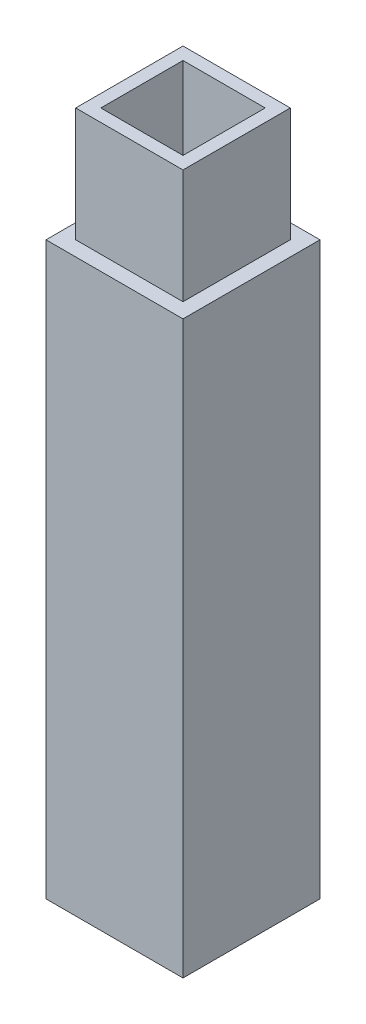
from build123d import *

# Parameters (mm, degrees)
SKETCH1_W           = 30
SKETCH1_H           = 30
BOSS_EXTRUDE1_DEPTH = 150
SKETCH2_W           = 25
SKETCH2_H           = 25
CUT_EXTRUDE1_DEPTH  = 27
SKETCH3_W           = 18
SKETCH3_H           = 18
CUT_EXTRUDE2_DEPTH  = 180
SKETCH4_OUTSIDE_W   = 63.176
SKETCH4_OUTSIDE_H   = 63.176
SKETCH4_OUTSIDE_W_2 = 23.5
SKETCH4_OUTSIDE_H_2 = 23.5
CUT_EXTRUDE3_DEPTH  = 25
WRAP1_DEPTH         = 2
SCALE1_SCALE        = 0.6


# Read off the part's stored shape, not the designer's step: Wrap1
with BuildPart() as part:
    # Sketch1 → Boss-Extrude1 (new body)
    with BuildSketch(Plane(origin=(0, 0, 0), x_dir=(1, 0, 0), z_dir=(0, 1, 0))):
        Rectangle(SKETCH1_W, SKETCH1_H)
    extrude(amount=BOSS_EXTRUDE1_DEPTH)

    # Sketch2 → Cut-Extrude1 (cut)
    with BuildSketch(Plane.XZ):
        Rectangle(SKETCH2_W, SKETCH2_H)
    extrude(amount=-CUT_EXTRUDE1_DEPTH, mode=Mode.SUBTRACT)

    # Sketch3 → Cut-Extrude2 (cut)
    with BuildSketch(Plane.XZ.offset(-27)):
        Rectangle(SKETCH3_W, SKETCH3_H)
    extrude(amount=-CUT_EXTRUDE2_DEPTH, mode=Mode.SUBTRACT)

    # Sketch4 outside → Cut-Extrude3 (cut)
    with BuildSketch(Plane(origin=(0, 150, 0), x_dir=(1, 0, 0), z_dir=(0, 1, 0))):
        Rectangle(SKETCH4_OUTSIDE_W, SKETCH4_OUTSIDE_H)
        Rectangle(SKETCH4_OUTSIDE_W_2, SKETCH4_OUTSIDE_H_2, mode=Mode.SUBTRACT)
    extrude(amount=-CUT_EXTRUDE3_DEPTH, mode=Mode.SUBTRACT)

    # Wrap1 outline → Wrap1 (add)
    # profile 1 of 3: a face of its own
    with BuildSketch(Plane(origin=(0, 0, -15), x_dir=(-1, 0, 0), z_dir=(0, 0, -1))):
        with BuildLine():
            add(Edge.make_bspline(
                [(-3.922817468, 45.671153846), (-4.093770018, 45.695144318), (-4.427682658, 45.742003647), (-4.912261402, 45.857196758), (-5.373060043, 45.990410607), (-5.807605616, 46.160772279), (-6.215429676, 46.357424097), (-6.596897172, 46.586746804), (-6.957482483, 46.838099681), (-7.173570101, 47.034893269), (-7.280990544, 47.132722356)],
                knots=[0, 0, 0, 0, 0.138943325, 0.2713907, 0.400711228, 0.524932707, 0.646800357, 0.764858493, 0.883107579, 1, 1, 1, 1], degree=3))
            Line((-3.922817468, 45.671153846), (-3.922817468, 49.090384615))
            add(Edge.make_bspline(
                [(-5.632432852, 51.318990385), (-5.626334799, 51.19510168), (-5.614234393, 50.949268545), (-5.523920172, 50.589786921), (-5.37188742, 50.248399145), (-5.162243215, 49.932174394), (-4.910469412, 49.645677437), (-4.612295603, 49.410546093), (-4.285585897, 49.21497499), (-4.044214327, 49.13207755), (-3.922817468, 49.090384615)],
                knots=[0, 0, 0, 0, 0.123522589, 0.245106649, 0.36726561, 0.494690546, 0.622323873, 0.746002836, 0.872253148, 1, 1, 1, 1], degree=3))
            add(Edge.make_bspline(
                [(-3.838863141, 53.242307692), (-3.96291507, 53.235739113), (-4.205038173, 53.222918636), (-4.552185339, 53.121395028), (-4.863278063, 52.949105261), (-5.134836655, 52.715335514), (-5.356350553, 52.428146835), (-5.521099871, 52.095778244), (-5.617208556, 51.719913909), (-5.627243154, 51.455658242), (-5.632432852, 51.318990385)],
                knots=[0, 0, 0, 0, 0.126165598, 0.246248538, 0.364494603, 0.485724426, 0.608514578, 0.73130473, 0.861036067, 1, 1, 1, 1], degree=3))
            add(Edge.make_bspline(
                [(-1.480509775, 49.578846154), (-1.49973988, 49.805523656), (-1.535715599, 50.229592373), (-1.621030319, 50.817817671), (-1.731395333, 51.314713669), (-1.875230857, 51.725960009), (-2.043241108, 52.073087117), (-2.237909176, 52.372077817), (-2.461449016, 52.632938242), (-2.713534917, 52.847506828), (-2.977772344, 53.026318164), (-3.258802638, 53.148723962), (-3.545444415, 53.230768998), (-3.741645367, 53.238484602), (-3.838863141, 53.242307692)],
                knots=[0, 0, 0, 0, 0.141725991, 0.265141262, 0.370116044, 0.458355648, 0.535986621, 0.609852304, 0.680090865, 0.749211452, 0.815601441, 0.878051616, 0.93957445, 1, 1, 1, 1], degree=3))
            Line((-1.480509775, 49.578846154), (1.694490225, 49.578846154))
            add(Edge.make_bspline(
                [(4.774087581, 54.219230769), (4.669487307, 54.21574812), (4.462503301, 54.208856622), (4.159178151, 54.148211769), (3.866273922, 54.05743537), (3.586207296, 53.926882058), (3.320625375, 53.756047239), (3.0673286, 53.548329617), (2.828333628, 53.301850127), (2.596679961, 53.024862706), (2.393891438, 52.706191395), (2.207153532, 52.358704643), (2.058464134, 51.973841824), (1.925689398, 51.560835854), (1.828704697, 51.111921243), (1.758286703, 50.62987205), (1.705870723, 50.115469842), (1.698350842, 49.760885548), (1.694490225, 49.578846154)],
                knots=[0, 0, 0, 0, 0.050616766, 0.100160932, 0.149266408, 0.198883313, 0.249304704, 0.301846101, 0.357178164, 0.415398685, 0.476408327, 0.539798233, 0.60615782, 0.675919782, 0.74976587, 0.828276339, 0.911839098, 1, 1, 1, 1], degree=3))
            add(Edge.make_bspline(
                [(7.556028686, 51.219771635), (7.554206103, 51.325465873), (7.55063607, 51.53249724), (7.511426253, 51.836673117), (7.446097642, 52.126146626), (7.359724625, 52.403321735), (7.242516917, 52.663842555), (7.10649776, 52.91360773), (6.939989719, 53.148049592), (6.750269608, 53.365802424), (6.547683461, 53.568457632), (6.326001113, 53.741501711), (6.095866991, 53.89089931), (5.851193975, 54.008784065), (5.599705966, 54.107446313), (5.33340958, 54.168980428), (5.058085174, 54.215162799), (4.869697977, 54.21786125), (4.774087581, 54.219230769)],
                knots=[0, 0, 0, 0, 0.069418935, 0.135976164, 0.201068785, 0.264244252, 0.326365932, 0.38847074, 0.450850536, 0.514855453, 0.578097235, 0.638796917, 0.699312171, 0.757998888, 0.816988375, 0.876385038, 0.937262852, 1, 1, 1, 1], degree=3))
            add(Edge.make_bspline(
                [(4.625259456, 48.113461538), (4.745067229, 48.135133073), (4.978424286, 48.177344069), (5.316306651, 48.259599587), (5.628070211, 48.367071915), (5.916005419, 48.489944677), (6.183067259, 48.625794939), (6.422114026, 48.78811245), (6.64254027, 48.962152835), (6.895905388, 49.223775189), (7.161612293, 49.58879831), (7.396934492, 50.08301815), (7.530771089, 50.635298908), (7.547422261, 51.020614884), (7.556028686, 51.219771635)],
                knots=[0, 0, 0, 0, 0.077370852, 0.150700025, 0.220747386, 0.286665961, 0.349581574, 0.410791325, 0.470003976, 0.527741387, 0.64173813, 0.755286834, 0.87351607, 1, 1, 1, 1], degree=3))
            Line((4.625259456, 48.113461538), (4.625259456, 44.694230769))
            add(Edge.make_bspline(
                [(10.975259456, 51.032782452), (10.970397844, 50.80992245), (10.960891605, 50.374149207), (10.878610295, 49.736739637), (10.745883863, 49.130942175), (10.558794952, 48.555210818), (10.316172607, 48.011773022), (10.027263832, 47.495700683), (9.675405042, 47.017291911), (9.276479808, 46.571216289), (8.828908345, 46.167369122), (8.343058426, 45.806424858), (7.81708256, 45.496342382), (7.253227938, 45.235850042), (6.650505389, 45.026984298), (6.010140578, 44.862231613), (5.330882432, 44.747149165), (4.863538377, 44.712100565), (4.625259456, 44.694230769)],
                knots=[0, 0, 0, 0, 0.066659045, 0.130342942, 0.191936224, 0.251995802, 0.311121943, 0.3697548, 0.428602208, 0.488435845, 0.548524359, 0.60866107, 0.669235799, 0.730880799, 0.794196272, 0.859830406, 0.928533466, 1, 1, 1, 1], degree=3))
            add(Edge.make_bspline(
                [(4.808432532, 57.638461538), (5.01980567, 57.631922573), (5.436590449, 57.619029066), (6.050470627, 57.537056171), (6.635755258, 57.384443352), (7.199158033, 57.183653083), (7.733483002, 56.915894192), (8.250697966, 56.600516797), (8.733262837, 56.214485064), (9.190438463, 55.781586679), (9.608109666, 55.30333781), (9.977126808, 54.788711), (10.281322916, 54.236709181), (10.541330776, 53.660677646), (10.734297497, 53.047639649), (10.875609648, 52.405525295), (10.961588259, 51.729645617), (10.970637793, 51.268362851), (10.975259456, 51.032782452)],
                knots=[0, 0, 0, 0, 0.062826775, 0.123881606, 0.183570574, 0.242287944, 0.301291813, 0.360878938, 0.421986412, 0.484557904, 0.547788277, 0.610411137, 0.672354816, 0.73480514, 0.797929196, 0.862961244, 0.93001333, 1, 1, 1, 1], degree=3))
            add(Edge.make_bspline(
                [(-0.064734535, 54.112379808), (-0.020158612, 54.248171501), (0.067431077, 54.514996089), (0.240044529, 54.894178684), (0.428281587, 55.25503478), (0.648028221, 55.589311724), (0.884053256, 55.906176268), (1.149047059, 56.195603245), (1.43620766, 56.465087272), (1.74858991, 56.707961648), (2.081000017, 56.9251026), (2.427463404, 57.116466799), (2.789246337, 57.277057329), (3.163690207, 57.411840157), (3.55448016, 57.514675721), (3.960291861, 57.58702427), (4.380147518, 57.628857125), (4.664601435, 57.635236085), (4.808432532, 57.638461538)],
                knots=[0, 0, 0, 0, 0.066210963, 0.130101573, 0.192891272, 0.254723742, 0.31534918, 0.375885633, 0.436387606, 0.497731609, 0.559069942, 0.62030329, 0.681020445, 0.742389955, 0.80461491, 0.86812333, 0.933317965, 1, 1, 1, 1], degree=3))
            add(Edge.make_bspline(
                [(-4.056381169, 56.661538462), (-3.849686337, 56.653444514), (-3.441521252, 56.637461208), (-2.845316687, 56.511056708), (-2.276533484, 56.307854264), (-1.741910918, 56.018930501), (-1.242005905, 55.656105382), (-0.794277884, 55.211169126), (-0.391792998, 54.696538146), (-0.175494857, 54.310208554), (-0.064734535, 54.112379808)],
                knots=[0, 0, 0, 0, 0.124097087, 0.245057399, 0.36448446, 0.485868975, 0.60892619, 0.734308661, 0.863946782, 1, 1, 1, 1], degree=3))
            add(Edge.make_bspline(
                [(-9.051663621, 51.341887019), (-9.047304761, 51.526521602), (-9.038736119, 51.889475986), (-8.969951713, 52.422927604), (-8.849311523, 52.931529079), (-8.691577183, 53.420656478), (-8.476953252, 53.883116328), (-8.227820548, 54.32911557), (-7.922248935, 54.746192966), (-7.576983763, 55.135324401), (-7.203545681, 55.49281584), (-6.804371082, 55.802404992), (-6.39012284, 56.068564342), (-5.957359336, 56.287844442), (-5.505348281, 56.456441039), (-5.036700883, 56.573452079), (-4.552451247, 56.650038645), (-4.223313292, 56.657668668), (-4.056381169, 56.661538462)],
                knots=[0, 0, 0, 0, 0.068213911, 0.134094803, 0.198285615, 0.261160186, 0.323634654, 0.38636675, 0.449642386, 0.514244902, 0.578413338, 0.640374686, 0.70061485, 0.760103977, 0.81929898, 0.878465984, 0.938360402, 1, 1, 1, 1], degree=3))
            add(Edge.make_bspline(
                [(-7.280990544, 47.132722356), (-7.422943154, 47.27347985), (-7.70271683, 47.550898077), (-8.061076005, 48.014496472), (-8.371211501, 48.500433206), (-8.617089164, 49.018453953), (-8.816098648, 49.560497919), (-8.949773769, 50.130875627), (-9.038468391, 50.727256307), (-9.04720512, 51.134211095), (-9.051663621, 51.341887019)],
                knots=[0, 0, 0, 0, 0.127406864, 0.251105539, 0.372907792, 0.494496302, 0.616171436, 0.740562898, 0.867604851, 1, 1, 1, 1], degree=3))
        make_face()
    # profile 2 of 3: a face of its own
    with BuildSketch(Plane(origin=(0, 0, -15), x_dir=(-1, 0, 0), z_dir=(0, 0, -1))):
        with BuildLine():
            add(Edge.make_bspline(
                [(-8.563202083, 65.366075721), (-8.560908429, 65.701971996), (-8.556474771, 66.351263294), (-8.504604086, 67.291824091), (-8.428442627, 68.167083056), (-8.311852555, 68.97504649), (-8.17661881, 69.718669735), (-7.995211546, 70.392312136), (-7.788360154, 71.000858388), (-7.544324704, 71.550218756), (-7.25995448, 72.051754595), (-6.943151965, 72.527972935), (-6.582354922, 72.977946575), (-6.184512387, 73.407988076), (-5.742349094, 73.812548233), (-5.263188012, 74.198364266), (-4.740080883, 74.555989688), (-4.185570099, 74.896234733), (-3.597305717, 75.203941101), (-2.980294914, 75.472334093), (-2.338508387, 75.69716853), (-1.671262157, 75.879858153), (-0.980771278, 76.025482867), (-0.265642407, 76.127373544), (0.473462369, 76.190363376), (0.974389966, 76.196753168), (1.228925321, 76.2)],
                knots=[0, 0, 0, 0, 0.060148874, 0.116268453, 0.168655952, 0.21743294, 0.262424792, 0.303924461, 0.342252181, 0.37743397, 0.411399132, 0.445391786, 0.479760229, 0.514578736, 0.550208327, 0.586996019, 0.624658544, 0.663611474, 0.703452918, 0.743447125, 0.784010829, 0.825130466, 0.867263092, 0.910305411, 0.954423665, 1, 1, 1, 1], degree=3))
            Line((-8.563202083, 65.366075721), (-8.563202083, 61.057692308))
            Line((-8.563202083, 61.057692308), (10.486797917, 61.057692308))
            Line((10.486797917, 61.057692308), (10.486797917, 65.430949519))
            add(Edge.make_bspline(
                [(1.228925321, 76.2), (1.588091275, 76.19149804), (2.295130479, 76.174761435), (3.332702367, 76.033781618), (4.327318506, 75.805769519), (5.271198626, 75.485163798), (6.155937326, 75.087698528), (6.96593265, 74.612881759), (7.696836801, 74.067675394), (8.345011033, 73.458431178), (8.90212405, 72.798767909), (9.379255944, 72.113245322), (9.755495421, 71.395182585), (9.994144976, 70.762475238), (10.142428339, 70.213823905), (10.230529745, 69.732164676), (10.309146507, 69.184678827), (10.379365828, 68.56773605), (10.426164746, 67.881397059), (10.4589358, 67.125545696), (10.483160202, 66.301173682), (10.485553573, 65.728624961), (10.486797917, 65.430949519)],
                knots=[0, 0, 0, 0, 0.065772437, 0.129476892, 0.191428604, 0.252443711, 0.311784541, 0.368814691, 0.42408823, 0.478488396, 0.531389624, 0.581999458, 0.631196377, 0.67949774, 0.705555904, 0.735216023, 0.769126523, 0.806877245, 0.848930943, 0.895117474, 0.945470227, 1, 1, 1, 1], degree=3))
        make_face()
        with BuildLine():
            add(Edge.make_bspline(
                [(7.067567148, 66.262860577), (7.066538319, 66.47532287), (7.064559838, 66.883896707), (7.037375746, 67.474505538), (6.993232009, 68.01955716), (6.927936774, 68.519765515), (6.849369892, 68.976280549), (6.752193017, 69.387437019), (6.634018534, 69.754045306), (6.494748711, 70.079128619), (6.335741313, 70.375922505), (6.150069703, 70.650878043), (5.943729654, 70.916243634), (5.710839348, 71.167114812), (5.4544318, 71.40442544), (5.173199956, 71.626775748), (4.867997971, 71.83713233), (4.537213255, 72.03009606), (4.184338662, 72.206427331), (3.812792384, 72.362852932), (3.419480216, 72.492552837), (3.008084041, 72.600351457), (2.575022186, 72.677385794), (2.123502279, 72.741117015), (1.651735438, 72.773972317), (1.330729512, 72.778481502), (1.167867629, 72.780769231)],
                knots=[0, 0, 0, 0, 0.062612326, 0.120406111, 0.174204843, 0.223728185, 0.269030291, 0.310675957, 0.348139427, 0.382401014, 0.41477486, 0.447215928, 0.480063858, 0.51375667, 0.547979264, 0.582933279, 0.619329216, 0.657136258, 0.695697859, 0.735523522, 0.775831512, 0.817659023, 0.860747747, 0.905390435, 0.951999977, 1, 1, 1, 1], degree=3))
            Line((7.067567148, 66.262860577), (7.067567148, 64.476923077))
            Line((7.067567148, 64.476923077), (-5.143971314, 64.476923077))
            Line((-5.143971314, 64.476923077), (-5.143971314, 65.78203125))
            add(Edge.make_bspline(
                [(-3.617529006, 70.983383413), (-3.741541623, 70.8416939), (-3.994823352, 70.552309111), (-4.298319635, 70.044244519), (-4.564970868, 69.484383652), (-4.776395558, 68.859918572), (-4.943599216, 68.176884457), (-5.058915491, 67.43121314), (-5.133016506, 66.626897855), (-5.140241479, 66.069686966), (-5.143971314, 65.78203125)],
                knots=[0, 0, 0, 0, 0.101663476, 0.207636138, 0.318744567, 0.436679942, 0.563506646, 0.698681208, 0.844446556, 1, 1, 1, 1], degree=3))
            add(Edge.make_bspline(
                [(1.167867629, 72.780769231), (0.91829152, 72.776229193), (0.431637447, 72.76737647), (-0.277090198, 72.681469049), (-0.943628127, 72.543047128), (-1.566264069, 72.341404648), (-2.148956397, 72.093437126), (-2.684196392, 71.77814124), (-3.180757211, 71.414671249), (-3.472002319, 71.127082916), (-3.617529006, 70.983383413)],
                knots=[0, 0, 0, 0, 0.142280365, 0.277435688, 0.406487662, 0.529917848, 0.650133875, 0.766844668, 0.88349908, 1, 1, 1, 1], degree=3))
        make_face(mode=Mode.SUBTRACT)
    # profile 3 of 3: a face of its own
    with BuildSketch(Plane(origin=(0, 0, -15), x_dir=(-1, 0, 0), z_dir=(0, 0, -1))):
        with BuildLine():
            add(Edge.make_bspline(
                [(-8.563202083, 83.435336538), (-8.562085989, 83.68467594), (-8.559932809, 84.165703911), (-8.533822568, 84.859385797), (-8.487031558, 85.499341388), (-8.429204881, 86.085423272), (-8.348135444, 86.617391724), (-8.255191672, 87.095908859), (-8.141972177, 87.521087044), (-8.007540554, 87.897678792), (-7.849189555, 88.235761959), (-7.680053152, 88.555321758), (-7.479568132, 88.851548599), (-7.262185848, 89.131397043), (-7.023383854, 89.392750179), (-6.764105947, 89.637544682), (-6.480584066, 89.863259849), (-6.17477142, 90.06848059), (-5.852894143, 90.254749707), (-5.514218214, 90.417459793), (-5.158250847, 90.549448011), (-4.787283088, 90.660167773), (-4.401334305, 90.749099484), (-3.998029994, 90.808295136), (-3.580186424, 90.848503836), (-3.295801817, 90.852051696), (-3.151964102, 90.853846154)],
                knots=[0, 0, 0, 0, 0.070782813, 0.136554884, 0.197017081, 0.252928598, 0.303693621, 0.349727315, 0.391249604, 0.428488557, 0.463067374, 0.497161963, 0.531014729, 0.564460573, 0.597691279, 0.631412817, 0.665589541, 0.700444444, 0.735874519, 0.771086765, 0.806970339, 0.84353075, 0.880937416, 0.9192925, 0.959179287, 1, 1, 1, 1], degree=3))
            Line((-8.563202083, 83.435336538), (-8.563202083, 79.619230769))
            Line((-8.563202083, 79.619230769), (10.486797917, 79.619230769))
            Line((10.486797917, 79.619230769), (10.486797917, 83.038461538))
            Line((10.486797917, 83.038461538), (2.182951763, 83.038461538))
            add(Edge.make_bspline(
                [(1.892927725, 86.919441106), (1.917224931, 86.821784161), (1.969860503, 86.61022777), (2.02329882, 86.26016005), (2.072432067, 85.856743758), (2.114656145, 85.398674386), (2.143358679, 84.885687846), (2.165774081, 84.318280841), (2.182072394, 83.696196234), (2.18265073, 83.263623198), (2.182951763, 83.038461538)],
                knots=[0, 0, 0, 0, 0.077372749, 0.167614291, 0.272108317, 0.390015992, 0.52136331, 0.667272254, 0.826809521, 1, 1, 1, 1], degree=3))
            add(Edge.make_bspline(
                [(-3.151964102, 90.853846154), (-2.992839865, 90.851249797), (-2.680141186, 90.846147636), (-2.22176327, 90.796130039), (-1.784741485, 90.710684136), (-1.365390084, 90.599010956), (-0.970609278, 90.443290111), (-0.590975994, 90.265388214), (-0.23714672, 90.046505462), (0.095352226, 89.796422496), (0.409046089, 89.523208736), (0.695538514, 89.220819088), (0.954743933, 88.892815246), (1.19787163, 88.548306359), (1.405454431, 88.173096745), (1.599084264, 87.780321186), (1.76315247, 87.360091586), (1.849267671, 87.067688348), (1.892927725, 86.919441106)],
                knots=[0, 0, 0, 0, 0.068872788, 0.135343493, 0.199281685, 0.261540067, 0.322903021, 0.382757342, 0.442826617, 0.502632784, 0.562727297, 0.622715739, 0.682661194, 0.743612561, 0.80501998, 0.868072172, 0.933113132, 1, 1, 1, 1], degree=3))
        make_face()
        with BuildLine():
            add(Edge.make_bspline(
                [(-1.236279006, 84.248167067), (-1.237674544, 84.468292348), (-1.240242355, 84.873326135), (-1.277382953, 85.426455626), (-1.334093161, 85.87097172), (-1.415457433, 86.222119654), (-1.53885591, 86.499464328), (-1.681854523, 86.738385479), (-1.862406305, 86.945016489), (-2.072193379, 87.120134593), (-2.308514579, 87.262433556), (-2.570736712, 87.362460719), (-2.85512052, 87.425537807), (-3.053672395, 87.431532525), (-3.155780208, 87.434615385)],
                knots=[0, 0, 0, 0, 0.155183108, 0.285539224, 0.390561991, 0.471046427, 0.538527135, 0.603746832, 0.666688199, 0.730994992, 0.79575053, 0.860207253, 0.928109812, 1, 1, 1, 1], degree=3))
            Line((-1.236279006, 84.248167067), (-1.236279006, 83.038461538))
            Line((-1.236279006, 83.038461538), (-5.143971314, 83.038461538))
            Line((-5.143971314, 83.038461538), (-5.143971314, 84.114603365))
            add(Edge.make_bspline(
                [(-4.766176843, 86.537830529), (-4.796760512, 86.477356067), (-4.861512407, 86.349319239), (-4.93679122, 86.131260108), (-5.000297191, 85.8796232), (-5.053006534, 85.592709683), (-5.093914459, 85.271664138), (-5.125198787, 84.916543843), (-5.137779434, 84.526826207), (-5.141850426, 84.25580091), (-5.143971314, 84.114603365)],
                knots=[0, 0, 0, 0, 0.08210116, 0.173824981, 0.278953094, 0.396639095, 0.527315592, 0.671298143, 0.82875438, 1, 1, 1, 1], degree=3))
            add(Edge.make_bspline(
                [(-3.155780208, 87.434615385), (-3.245014127, 87.431629869), (-3.418149383, 87.42583725), (-3.667850756, 87.382696631), (-3.900167408, 87.31574019), (-4.111860911, 87.213410259), (-4.307868824, 87.089172397), (-4.482089371, 86.931561219), (-4.64015918, 86.749803136), (-4.723722664, 86.609242129), (-4.766176843, 86.537830529)],
                knots=[0, 0, 0, 0, 0.137806221, 0.267377201, 0.390496855, 0.51006691, 0.629459141, 0.747795142, 0.871868075, 1, 1, 1, 1], degree=3))
        make_face(mode=Mode.SUBTRACT)
    extrude(amount=WRAP1_DEPTH)


with BuildPart() as part_1:
    # Scale1: scaled about (-0.006188327, 74.292732368, -0.190238377)
    add(part.part.scale(SCALE1_SCALE).moved(Location((-0.002475331, 29.717092947, -0.076095351))))


solid = part_1.part
